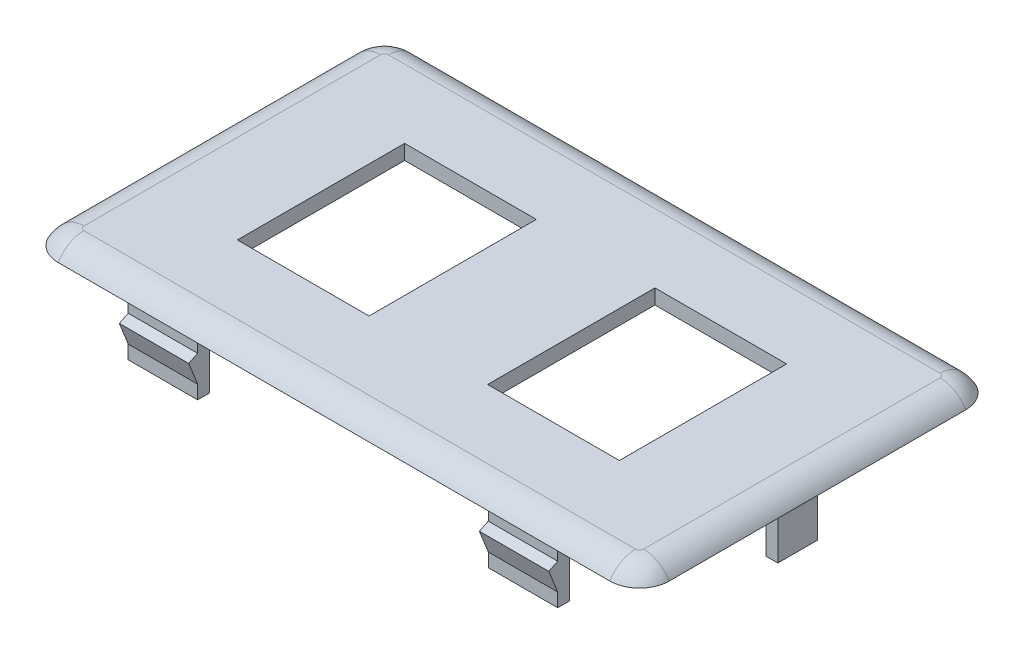
from build123d import *

# Parameters (mm, degrees)
BOSS_EXTRUDE1_DEPTH  = 2.5
FILLET1_R            = 5
BOSS_EXTRUDE2_DEPTH  = 9.8
CUT_EXTRUDE1_DEPTH   = 9.8
CUT_EXTRUDE2_DEPTH   = 89.657557489
BOSS_EXTRUDE3_DEPTH  = 11.7
MIRROR4_COPY_1_DEPTH = 11.7
SKETCH8_W            = 22.2
SKETCH8_H            = 28.2
CUT_EXTRUDE3_DEPTH   = 10


with BuildPart() as part:
    # Sketch1 → Boss-Extrude1 (new body)
    with BuildSketch(Plane(origin=(0, 0, 0), x_dir=(1, 0, 0), z_dir=(0, 1, 0))):
        with BuildLine():
            Line((-46.5, 30), (46.5, 30))
            ThreePointArc((46.5, 30), (50.035533906, 28.535533906), (51.5, 25))
            Line((51.5, 25), (51.5, -25))
            ThreePointArc((51.5, -25), (50.035533906, -28.535533906), (46.5, -30))
            Line((46.5, -30), (-46.5, -30))
            ThreePointArc((-46.5, -30), (-50.035533906, -28.535533906), (-51.5, -25))
            Line((-51.5, -25), (-51.5, 25))
            ThreePointArc((-51.5, 25), (-50.035533906, 28.535533906), (-46.5, 30))
        make_face()
    extrude(amount=BOSS_EXTRUDE1_DEPTH)

    # Fillet1
    # the kernel refuses this fillet: 5 mm, written as the material it takes off along each edge
    with BuildSketch(Plane(origin=(-46.5, 2.5, -25), x_dir=(-1, 0, 0), z_dir=(0, 0, 1))) as fillet1_piece_1:
        with BuildLine():
            CenterArc((0.669872981, 5), FILLET1_R, 270, 60)
            Line((0.669872981, 0), (0.669872981, -0.1))
            Line((0.669872981, -0.1), (5, -0.1))
            Line((5, -0.1), (5.1, 0))
            ThreePointArc((5.1, 0), (5.1, 1.25), (5.08660254, 2.45))
            Line((5.08660254, 2.45), (5, 2.5))
        make_face()
    revolve(axis=Axis((-46.5, 2.5, -25), (0, -1, 0)), revolution_arc=90, mode=Mode.SUBTRACT)
    with BuildSketch(Plane(origin=(-46.5, 2.5, -30), x_dir=(0, -1, 0), z_dir=(1, 0, 0)), Plane(origin=(46.5, 2.5, 30), x_dir=(0, -1, 0), z_dir=(-1, 0, 0))) as fillet1_piece_2:
        with BuildLine():
            CenterArc((5, -4.330127019), FILLET1_R, 120, 60)
            Line((0, -4.330127019), (-0.1, -4.330127019))
            Line((-0.1, -4.330127019), (-0.1, 0))
            Line((-0.1, 0), (0, 0.1))
            ThreePointArc((0, 0.1), (1.25, 0.1), (2.45, 0.08660254))
            Line((2.45, 0.08660254), (2.5, 0))
        make_face()
    extrude(amount=93, mode=Mode.SUBTRACT)
    with BuildSketch(Plane(origin=(46.5, 2.5, -25), x_dir=(0, 0, -1), z_dir=(-1, 0, 0))) as fillet1_piece_3:
        with BuildLine():
            CenterArc((0.669872981, 5), FILLET1_R, 270, 60)
            Line((0.669872981, 0), (0.669872981, -0.1))
            Line((0.669872981, -0.1), (5, -0.1))
            Line((5, -0.1), (5.1, 0))
            ThreePointArc((5.1, 0), (5.1, 1.25), (5.08660254, 2.45))
            Line((5.08660254, 2.45), (5, 2.5))
        make_face()
    revolve(axis=Axis((46.5, 2.5, -25), (0, -1, 0)), revolution_arc=90, mode=Mode.SUBTRACT)
    with BuildSketch(Plane(origin=(51.5, 2.5, -25), x_dir=(0, -1, 0), z_dir=(0, 0, 1)), Plane(origin=(-51.5, 2.5, 25), x_dir=(0, -1, 0), z_dir=(0, 0, -1))) as fillet1_piece_4:
        with BuildLine():
            CenterArc((5, -4.330127019), FILLET1_R, 120, 60)
            Line((0, -4.330127019), (-0.1, -4.330127019))
            Line((-0.1, -4.330127019), (-0.1, 0))
            Line((-0.1, 0), (0, 0.1))
            ThreePointArc((0, 0.1), (1.25, 0.1), (2.45, 0.08660254))
            Line((2.45, 0.08660254), (2.5, 0))
        make_face()
    extrude(amount=50, mode=Mode.SUBTRACT)
    with BuildSketch(Plane(origin=(46.5, 2.5, 25), x_dir=(1, 0, 0), z_dir=(0, 0, -1))) as fillet1_piece_5:
        with BuildLine():
            CenterArc((0.669872981, 5), FILLET1_R, 270, 60)
            Line((0.669872981, 0), (0.669872981, -0.1))
            Line((0.669872981, -0.1), (5, -0.1))
            Line((5, -0.1), (5.1, 0))
            ThreePointArc((5.1, 0), (5.1, 1.25), (5.08660254, 2.45))
            Line((5.08660254, 2.45), (5, 2.5))
        make_face()
    revolve(axis=Axis((46.5, 2.5, 25), (0, -1, 0)), revolution_arc=90, mode=Mode.SUBTRACT)
    with BuildSketch(Plane(origin=(-46.5, 2.5, 25), x_dir=(0, 0, 1), z_dir=(1, 0, 0))) as fillet1_piece_6:
        with BuildLine():
            CenterArc((0.669872981, 5), FILLET1_R, 270, 60)
            Line((0.669872981, 0), (0.669872981, -0.1))
            Line((0.669872981, -0.1), (5, -0.1))
            Line((5, -0.1), (5.1, 0))
            ThreePointArc((5.1, 0), (5.1, 1.25), (5.08660254, 2.45))
            Line((5.08660254, 2.45), (5, 2.5))
        make_face()
    revolve(axis=Axis((-46.5, 2.5, 25), (0, -1, 0)), revolution_arc=90, mode=Mode.SUBTRACT)

    # Sketch2 → Boss-Extrude2 (add)
    with BuildSketch(Plane.XZ):
        Polygon((-36.2, 28.5), (-24.5, 28.5), (-24.5, 26.5), (-29.35, 26.5), (-29.35, 20.5), (-31.35, 20.5), (-31.35, 26.5), (-36.2, 26.5), align=None)
        Polygon((48.225, -3.282847821), (46.225, -3.282847821), (46.225, -0.999790058), (40.225, -0.999790058), (40.225, 1), (46.225, 1), (46.225, 3.417152179), (48.225, 3.417152179), align=None)
        Polygon((24.5, 28.5), (36.2, 28.5), (36.2, 26.5), (31.35, 26.5), (31.35, 20.5), (29.35, 20.5), (29.35, 26.5), (24.5, 26.5), align=None)
        Polygon((24.5, -26.5), (29.35, -26.5), (29.35, -20.5), (31.35, -20.5), (31.35, -26.5), (36.2, -26.5), (36.2, -28.5), (24.5, -28.5), align=None)
        Polygon((-36.2, -28.5), (-24.5, -28.5), (-24.5, -26.5), (-29.35, -26.5), (-29.35, -20.5), (-31.35, -20.5), (-31.35, -26.5), (-36.2, -26.5), align=None)
        Polygon((-48.225, 3.417152179), (-46.225, 3.417152179), (-46.225, 1), (-40.225, 1), (-40.225, -0.999790058), (-46.225, -0.999790058), (-46.225, -3.282847821), (-48.225, -3.282847821), align=None)
    extrude(amount=BOSS_EXTRUDE2_DEPTH)

    # Sketch4 → Cut-Extrude1 (cut)
    with BuildSketch(Plane(origin=(0, 0, -0.999790058), x_dir=(-1, 0, 0), z_dir=(0, 0, -1))):
        Polygon((40.225, 0), (46.225, -9.8), (40.225, -9.8), align=None)
    cut_extrude1 = extrude(amount=-CUT_EXTRUDE1_DEPTH, mode=Mode.SUBTRACT)

    # Mirror1: Cut-Extrude1 across plane
    add(cut_extrude1.mirror(Plane(origin=(0, 0, 0), x_dir=(0, 0, 1), z_dir=(1, 0, 0))), mode=Mode.SUBTRACT)

    # Sketch5 → Cut-Extrude2 (cut, through all)
    with BuildSketch(Plane.ZY.offset(31.35)):
        Polygon((-26.5, -9.8), (-20.5, 0), (-20.5, -9.8), align=None)
    cut_extrude2 = extrude(amount=-CUT_EXTRUDE2_DEPTH, mode=Mode.SUBTRACT)

    # Mirror2: Cut-Extrude2 across plane
    add(cut_extrude2.mirror(Plane.XY), mode=Mode.SUBTRACT)

    # Sketch6 → Boss-Extrude3 (add)
    with BuildSketch(Plane(origin=(36.2, 0, 0), x_dir=(0, 0, -1), z_dir=(1, 0, 0))):
        Polygon((-28.5, -3), (-28.5, -7.5), (-30, -3.726144837), align=None)
    boss_extrude3 = extrude(amount=-BOSS_EXTRUDE3_DEPTH)

    # Mirror3: Boss-Extrude3 across plane
    add(boss_extrude3.mirror(Plane(origin=(0, 0, 0), x_dir=(0, 0, 1), z_dir=(1, 0, 0))))

    # Mirror4: Boss-Extrude3 across plane
    add(boss_extrude3.mirror(Plane.XY))

    # Mirror4 copy 1 sketch → Mirror4 copy 1 (add)
    with BuildSketch(Plane.ZY.offset(36.2)):
        Polygon((-28.5, -3), (-28.5, -7.5), (-30, -3.726144837), align=None)
    extrude(amount=-MIRROR4_COPY_1_DEPTH)

    # Sketch8 → Cut-Extrude3 (cut)
    with BuildSketch(Plane.XZ):
        with Locations((-21.1, 0)):
            Rectangle(SKETCH8_W, SKETCH8_H)
        with Locations((21.1, 0)):
            Rectangle(SKETCH8_W, SKETCH8_H)
    extrude(amount=-CUT_EXTRUDE3_DEPTH, mode=Mode.SUBTRACT)


solid = part.part
